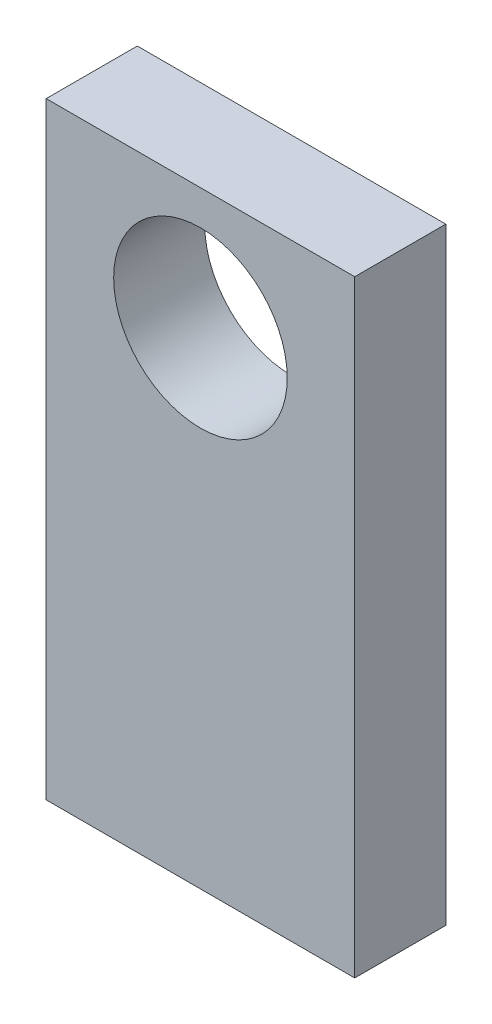
from build123d import *

# Parameters (mm, degrees)
CROQUIS1_W              = 50.8
CROQUIS1_H              = 15
SALIENTE_EXTRUIR1_DEPTH = 100
CROQUIS2_R              = 14.29
CORTAR_EXTRUIR1_DEPTH   = 105.260059467


with BuildPart() as part:
    # Croquis1 → Saliente-Extruir1 (new body)
    with BuildSketch(Plane(origin=(0, 0, 0), x_dir=(1, 0, 0), z_dir=(0, 1, 0))):
        Rectangle(CROQUIS1_W, CROQUIS1_H)
    extrude(amount=SALIENTE_EXTRUIR1_DEPTH)

    # Croquis2 → Cortar-Extruir1 (cut, through all)
    with BuildSketch(Plane.XY.offset(7.5)):
        with Locations((0, 80)):
            Circle(CROQUIS2_R)
    extrude(amount=-CORTAR_EXTRUIR1_DEPTH, mode=Mode.SUBTRACT)


solid = part.part
